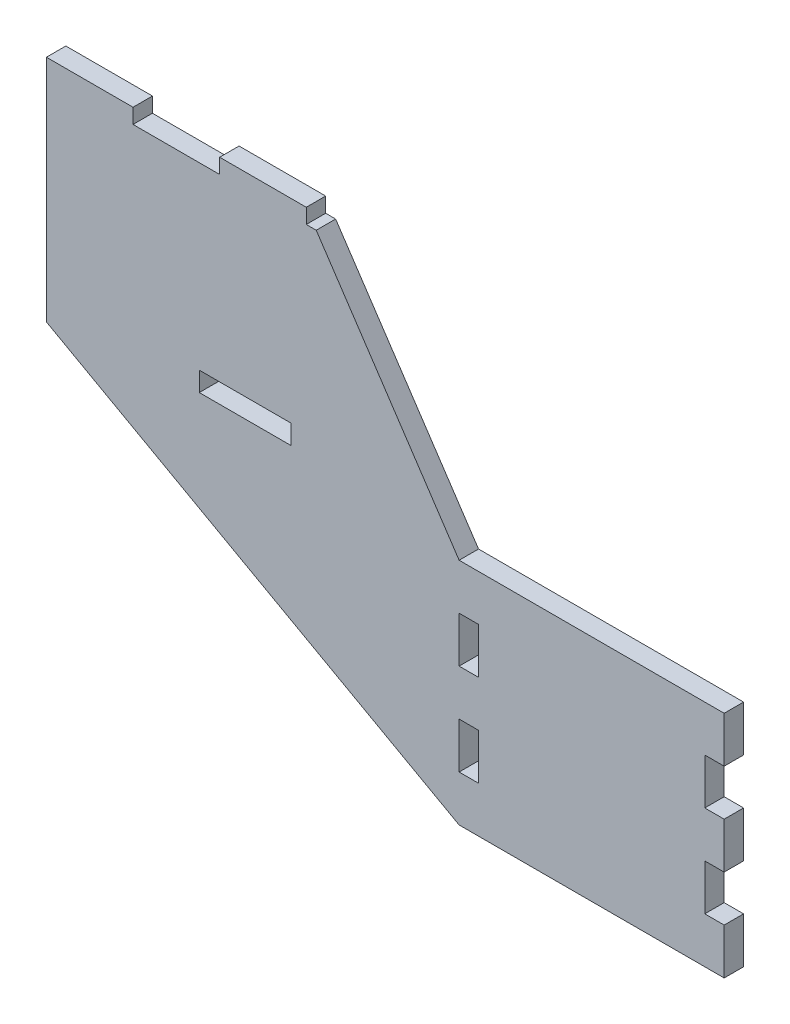
from build123d import *

# Parameters (mm, degrees)
BODY_DEPTH               = 6.35
CROSS_SUPPORT_REACH      = 156.565
SKETCH2_W                = 30
SKETCH2_H                = 6.35
SIDE_SUPPORTS_REACH      = 156.565
SKETCH3_W                = 6.35
SKETCH3_H                = 15
TOP_MOUNTING_TEETH_REACH = 156.565
SKETCH4_W                = 28.333333334
SKETCH4_H                = 4.883913905


with BuildPart() as part:
    # Sketch1 → Body (new body)
    with BuildSketch(Plane.XY):
        Polygon((86.7, -75), (86.7, 0), (0, 0), (-50, 75), (-135, 75), (-135, 0), (0, -75), align=None)
    extrude(amount=BODY_DEPTH)

    # Sketch2 → Cross support (cut, up to next)
    with BuildSketch(Plane.XY.offset(6.35), mode=Mode.PRIVATE) as cross_support_sk1:
        with Locations((-70, 8.175)):
            Rectangle(SKETCH2_W, SKETCH2_H)
    cross_support_tool1 = extrude(cross_support_sk1.sketch, amount=-CROSS_SUPPORT_REACH, mode=Mode.PRIVATE) & part.part
    add(cross_support_tool1.solids().sort_by_distance((-70, 8.175, 6.35))[0], mode=Mode.SUBTRACT)

    # Sketch3 → Side supports (cut, up to next)
    with BuildSketch(Plane.XY.offset(6.35), mode=Mode.PRIVATE) as side_supports_sk1:
        with Locations((83.525, -22.5)):
            Rectangle(SKETCH3_W, SKETCH3_H)
    side_supports_tool1 = extrude(side_supports_sk1.sketch, amount=-SIDE_SUPPORTS_REACH, mode=Mode.PRIVATE) & part.part
    # Sketch3 → Side supports (cut, up to next)
    with BuildSketch(Plane.XY.offset(6.35), mode=Mode.PRIVATE) as side_supports_sk2:
        with Locations((83.525, -52.5)):
            Rectangle(SKETCH3_W, SKETCH3_H)
    side_supports_tool2 = extrude(side_supports_sk2.sketch, amount=-SIDE_SUPPORTS_REACH, mode=Mode.PRIVATE) & part.part
    # Sketch3 → Side supports (cut, up to next)
    with BuildSketch(Plane.XY.offset(6.35), mode=Mode.PRIVATE) as side_supports_sk3:
        with Locations((3.175, -52.5)):
            Rectangle(SKETCH3_W, SKETCH3_H)
    side_supports_tool3 = extrude(side_supports_sk3.sketch, amount=-SIDE_SUPPORTS_REACH, mode=Mode.PRIVATE) & part.part
    # Sketch3 → Side supports (cut, up to next)
    with BuildSketch(Plane.XY.offset(6.35), mode=Mode.PRIVATE) as side_supports_sk4:
        with Locations((3.175, -22.5)):
            Rectangle(SKETCH3_W, SKETCH3_H)
    side_supports_tool4 = extrude(side_supports_sk4.sketch, amount=-SIDE_SUPPORTS_REACH, mode=Mode.PRIVATE) & part.part
    add(side_supports_tool1.solids().sort_by_distance((83.525, -22.5, 6.35))[0], mode=Mode.SUBTRACT)
    add(side_supports_tool2.solids().sort_by_distance((83.525, -52.5, 6.35))[0], mode=Mode.SUBTRACT)
    add(side_supports_tool3.solids().sort_by_distance((3.175, -52.5, 6.35))[0], mode=Mode.SUBTRACT)
    add(side_supports_tool4.solids().sort_by_distance((3.175, -22.5, 6.35))[0], mode=Mode.SUBTRACT)

    # Sketch4 → Top mounting teeth (cut, up to next)
    with BuildSketch(Plane.XY.offset(6.35), mode=Mode.PRIVATE) as top_mounting_teeth_sk1:
        with Locations((-92.5, 72.558043048)):
            Rectangle(SKETCH4_W, SKETCH4_H)
    top_mounting_teeth_tool1 = extrude(top_mounting_teeth_sk1.sketch, amount=-TOP_MOUNTING_TEETH_REACH, mode=Mode.PRIVATE) & part.part
    # Sketch4 → Top mounting teeth (cut, up to next)
    with BuildSketch(Plane.XY.offset(6.35), mode=Mode.PRIVATE) as top_mounting_teeth_sk2:
        Polygon((-46.744057396, 70.116086095), (-50, 70.116086095), (-50, 75), align=None)
    top_mounting_teeth_tool2 = extrude(top_mounting_teeth_sk2.sketch, amount=-TOP_MOUNTING_TEETH_REACH, mode=Mode.PRIVATE) & part.part
    add(top_mounting_teeth_tool1.solids().sort_by_distance((-92.5, 72.558043, 6.35))[0], mode=Mode.SUBTRACT)
    add(top_mounting_teeth_tool2.solids().sort_by_distance((-48.914686, 71.744057, 6.35))[0], mode=Mode.SUBTRACT)


solid = part.part
